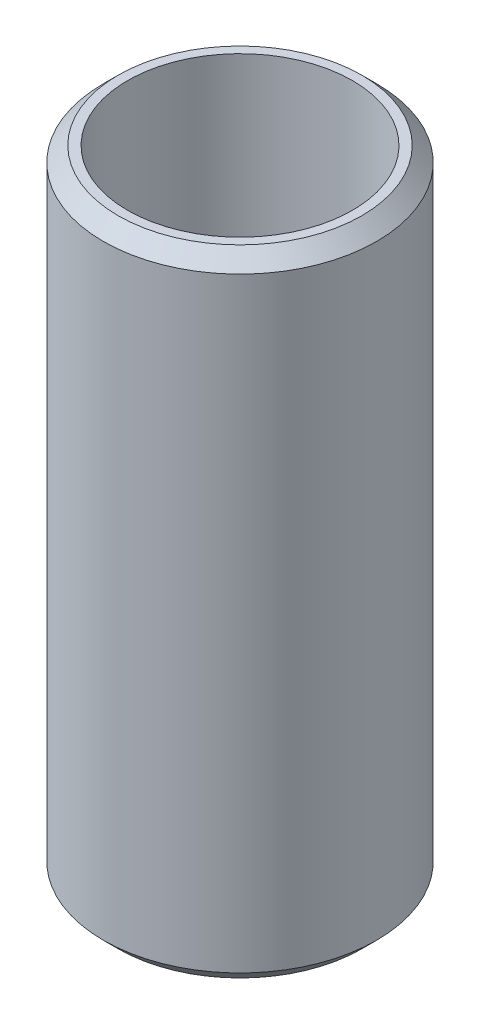
from build123d import *

# Parameters (mm, degrees)
SKETCH1_R           = 42.5
BOSS_EXTRUDE1_DEPTH = 197.485481715
SKETCH2_R           = 34.971958776
CUT_EXTRUDE1_DEPTH  = 207.429202121
CHAMFER1_SIZE       = 4.616539791


with BuildPart() as part:
    # Sketch1 → Boss-Extrude1 (new body)
    with BuildSketch(Plane(origin=(0, 0, 0), x_dir=(1, 0, 0), z_dir=(0, 1, 0))):
        Circle(SKETCH1_R)
    extrude(amount=BOSS_EXTRUDE1_DEPTH)

    # Sketch2 → Cut-Extrude1 (cut, through all)
    with BuildSketch(Plane(origin=(0, 0, 0), x_dir=(1, 0, 0), z_dir=(0, 1, 0))):
        Circle(SKETCH2_R)
    extrude(amount=CUT_EXTRUDE1_DEPTH, mode=Mode.SUBTRACT)

    # Chamfer1
    chamfer1_edges = [part.edges().sort_by_distance(p)[0] for p in [
        (-42.5, 197.485481715, 0),
        (-42.5, 0, 0),
    ]]
    chamfer(chamfer1_edges, length=CHAMFER1_SIZE)


solid = part.part
